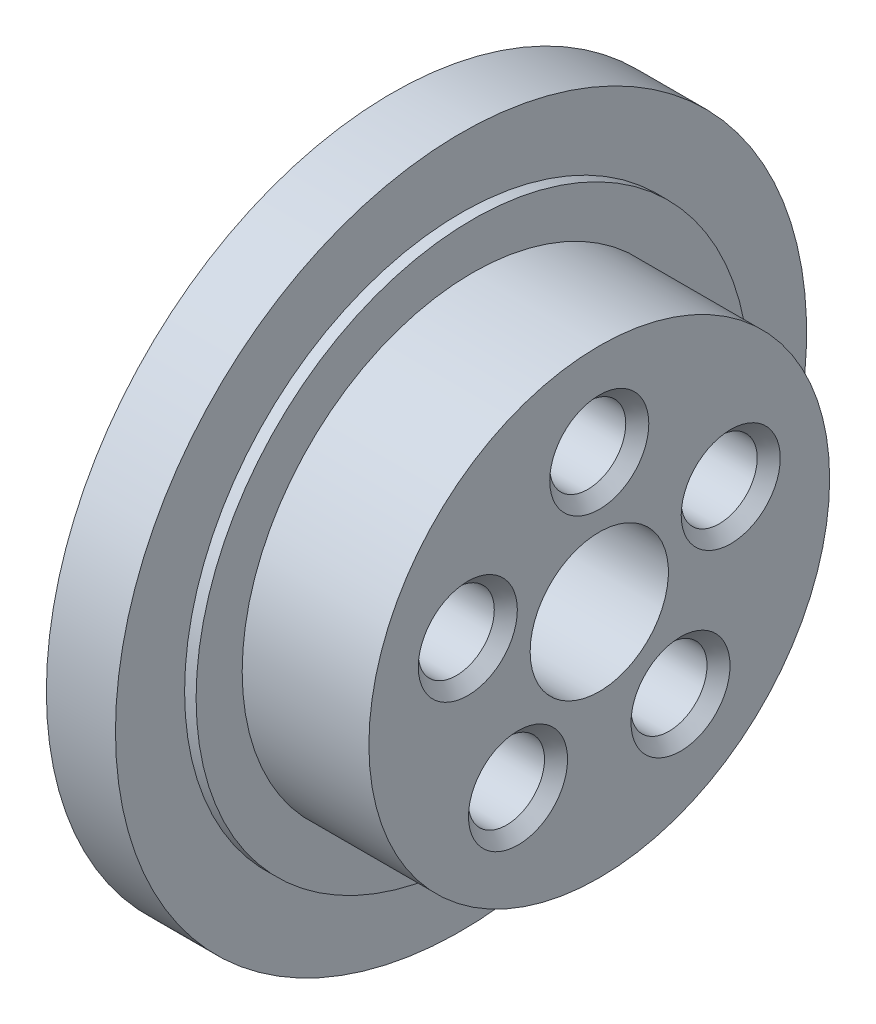
from build123d import *

# Parameters (mm, degrees)
SKETCH2_R          = 2.5
CUT_EXTRUDE1_DEPTH = 4
SKETCH3_R          = 3.3
CUT_EXTRUDE2_DEPTH = 10.5
CHAMFER1_SIZE      = 1


with BuildPart() as part:
    # Sketch1 → Revolve1 (revolve)
    with BuildSketch(Plane.XY):
        Polygon((0, 30), (6, 30), (6, 24), (7, 24), (7, 20), (18, 20), (18, 6), (6, 6), (6, 7.5), (0, 7.5), align=None)
    revolve(axis=Axis((0, 0, 0), (1, 0, 0)))

    # Sketch2 → Cut-Extrude1 (cut)
    with BuildSketch(Plane.ZY):
        with Locations((0, 20)):
            Circle(SKETCH2_R)
        with Locations((17.320508076, 10)):
            Circle(SKETCH2_R)
        with Locations((17.320508076, -10)):
            Circle(SKETCH2_R)
        with Locations((0, -20)):
            Circle(SKETCH2_R)
        with Locations((-17.320508076, -10)):
            Circle(SKETCH2_R)
        with Locations((-17.320508076, 10)):
            Circle(SKETCH2_R)
    extrude(amount=-CUT_EXTRUDE1_DEPTH, mode=Mode.SUBTRACT)

    # Sketch3 → Cut-Extrude2 (cut)
    with BuildSketch(Plane(origin=(18, 0, 0), x_dir=(0, 0, -1), z_dir=(1, 0, 0))):
        with Locations((0, 12)):
            Circle(SKETCH3_R)
        with Locations((11.412678196, 3.708203932)):
            Circle(SKETCH3_R)
        with Locations((7.053423028, -9.708203932)):
            Circle(SKETCH3_R)
        with Locations((-7.053423028, -9.708203932)):
            Circle(SKETCH3_R)
        with Locations((-11.412678196, 3.708203932)):
            Circle(SKETCH3_R)
    extrude(amount=-CUT_EXTRUDE2_DEPTH, mode=Mode.SUBTRACT)

    # Chamfer1
    chamfer1_edges = [part.edges().sort_by_distance(p)[0] for p in [
        (18, 3.708203932, 14.712678196),
        (18, -9.708203932, 10.353423028),
        (18, -9.708203932, -3.753423028),
        (18, 3.708203932, -8.112678196),
        (18, 12, 3.3),
    ]]
    chamfer(chamfer1_edges, length=CHAMFER1_SIZE)


solid = part.part
